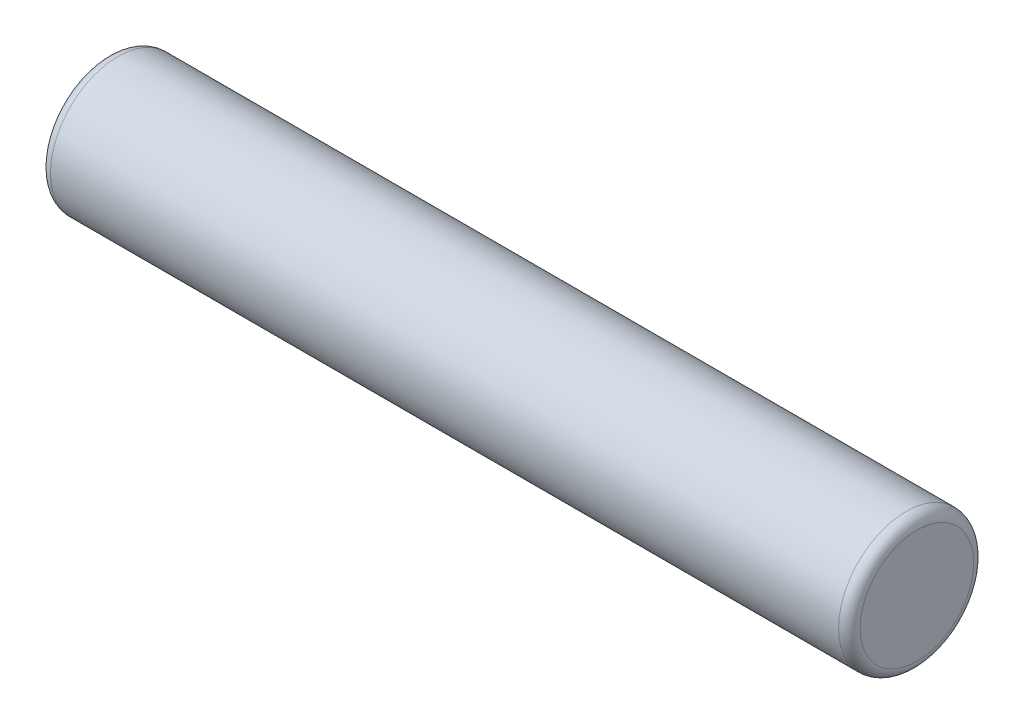
from build123d import *


with BuildPart() as part:
    # Sketch1 → Base-Revolve (revolve)
    with BuildSketch(Plane.XY):
        with BuildLine():
            Line((0, 0), (38.1, 0))
            Line((38.1, 0), (38.1, 2.66954))
            ThreePointArc((38.1, 2.66954), (37.951210245, 3.028750245), (37.592, 3.17754))
            Line((37.592, 3.17754), (0.508, 3.17754))
            ThreePointArc((0.508, 3.17754), (0.148789755, 3.028750245), (0, 2.66954))
            Line((0, 2.66954), (0, 0))
        make_face()
    revolve(axis=Axis((-6.35, 0, 0), (1, 0, 0)))


solid = part.part
